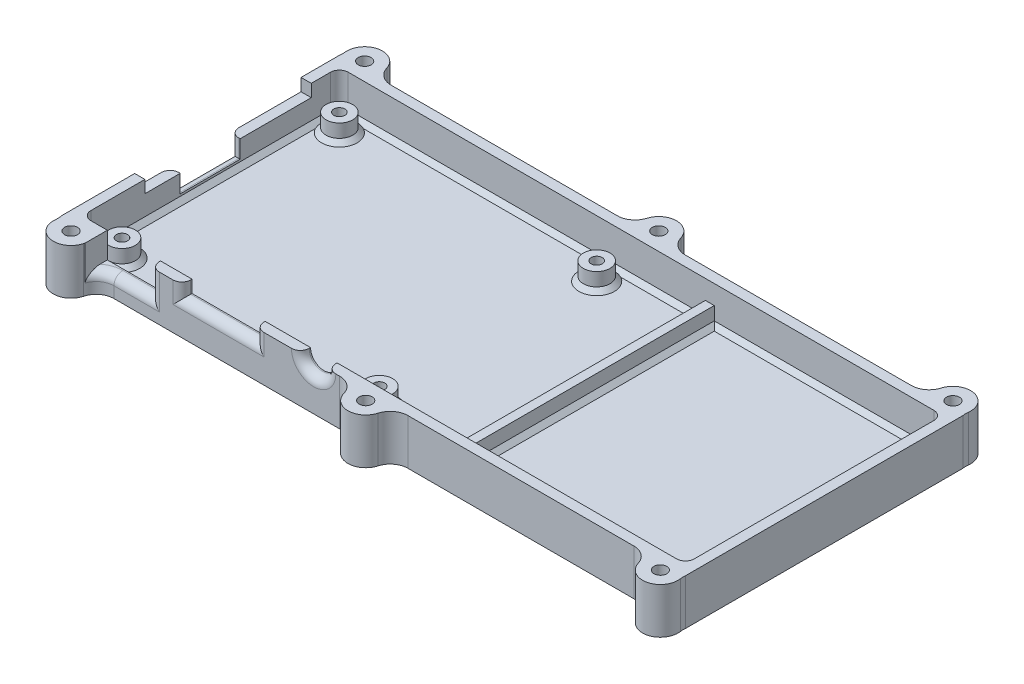
from build123d import *

# Parameters (mm, degrees)
SKETCH3_W                      = 140.6
SKETCH3_H                      = 62.6
SKETCH3_W_2                    = 136
SKETCH3_H_2                    = 58
BOSS_EXTRUDE1_DEPTH            = 10.3
SKETCH5_W                      = 136
SKETCH5_H                      = 58
BOSS_EXTRUDE2_DEPTH            = 2
SKETCH6_R                      = 3
BOSS_EXTRUDE3_DEPTH            = 4
F_2_5_2_5_DIAMETER_HOLE1_D     = 2.5
F_2_5_2_5_DIAMETER_HOLE1_DEPTH = 8
F_2_5_2_5_DIAMETER_HOLE1_TIP   = 0.751075774
SKETCH10_W                     = 2
SKETCH10_H                     = 58
BOSS_EXTRUDE4_DEPTH            = 4
CUT_EXTRUDE1_REACH             = 100.128
SKETCH11_R                     = 3
SKETCH11_W                     = 12
SKETCH11_H                     = 5.8
SKETCH11_W_2                   = 16.5
SKETCH11_H_2                   = 2.8
CUT_EXTRUDE2_REACH             = 147.115
SKETCH12_W                     = 13.5
SKETCH12_H                     = 6.8
SKETCH12_W_2                   = 37.5
SKETCH12_H_2                   = 2.8
SKETCH13_R                     = 4
BOSS_EXTRUDE5_DEPTH            = 10.3
FILLET2_R                      = 4
FILLET3_R                      = 4
FILLET4_R                      = 4
F_2_9_2_9_DIAMETER_HOLE1_D     = 2.9
FILLET6_R                      = 2
FILLET7_R                      = 2
FILLET8_R                      = 2
CHAMFER1_SIZE                  = 1
CHAMFER2_SIZE                  = 1
FILLET9_R                      = 2


with BuildPart() as part:
    # Sketch3 → Boss-Extrude1 (new body)
    with BuildSketch(Plane(origin=(0, 0, 0), x_dir=(1, 0, 0), z_dir=(0, 1, 0))):
        with Locations((-4.561766162, 3.105993834)):
            Rectangle(SKETCH3_W, SKETCH3_H)
        with Locations((-4.561766162, 3.105993834)):
            Rectangle(SKETCH3_W_2, SKETCH3_H_2, mode=Mode.SUBTRACT)
    extrude(amount=BOSS_EXTRUDE1_DEPTH)

    # Sketch5 → Boss-Extrude2 (add)
    with BuildSketch(Plane(origin=(0, 0, 0), x_dir=(1, 0, 0), z_dir=(0, 1, 0))):
        with Locations((-4.561766162, 3.105993834)):
            Rectangle(SKETCH5_W, SKETCH5_H)
    extrude(amount=BOSS_EXTRUDE2_DEPTH)

    # Sketch6 → Boss-Extrude3 (add)
    with BuildSketch(Plane(origin=(0, 2, 0), x_dir=(1, 0, 0), z_dir=(0, 1, 0))):
        with Locations(Location((-68.061766162, 27.605993834, 0), (0, 0, 270))):
            Circle(SKETCH6_R)
        with Locations(Location((-68.061766162, -21.394006166, 0), (0, 0, 270))):
            Circle(SKETCH6_R)
        with Locations(Location((-10.061766162, -21.394006166, 0), (0, 0, 270))):
            Circle(SKETCH6_R)
        with Locations(Location((-10.061766162, 27.605993834, 0), (0, 0, 270))):
            Circle(SKETCH6_R)
    extrude(amount=BOSS_EXTRUDE3_DEPTH)

    # Ø2.5 (2.5) Diameter Hole1
    with Locations(Plane(origin=(0, 6, 0), x_dir=(1, 0, 0), z_dir=(0, 1, 0))):
        with Locations((-68.061766162, 27.605993834), (-10.061766162, 27.605993834), (-10.061766162, -21.394006166), (-68.061766162, -21.394006166)):
            Hole(F_2_5_2_5_DIAMETER_HOLE1_D / 2, depth=F_2_5_2_5_DIAMETER_HOLE1_DEPTH)
            with Locations((0, 0, -(F_2_5_2_5_DIAMETER_HOLE1_DEPTH + F_2_5_2_5_DIAMETER_HOLE1_TIP / 2))):  # 118° drill point
                Cone(0, F_2_5_2_5_DIAMETER_HOLE1_D / 2, F_2_5_2_5_DIAMETER_HOLE1_TIP, mode=Mode.SUBTRACT)

    # Sketch10 → Boss-Extrude4 (add)
    with BuildSketch(Plane(origin=(0, 2, 0), x_dir=(1, 0, 0), z_dir=(0, 1, 0))):
        with Locations((10.938233838, 3.105993834)):
            Rectangle(SKETCH10_W, SKETCH10_H)
    extrude(amount=BOSS_EXTRUDE4_DEPTH)

    # Sketch11 → Cut-Extrude1 (cut, up to next)
    with BuildSketch(Plane.XY.offset(28.194006166), mode=Mode.PRIVATE) as cut_extrude1_sk1:
        with Locations((-18.061766162, 10.3)):
            Circle(SKETCH11_R)
    cut_extrude1_tool1 = extrude(cut_extrude1_sk1.sketch, amount=-CUT_EXTRUDE1_REACH, mode=Mode.PRIVATE) & part.part
    # Sketch11 → Cut-Extrude1 (cut, up to next)
    with BuildSketch(Plane.XY.offset(28.194006166), mode=Mode.PRIVATE) as cut_extrude1_sk2:
        with Locations((-60.861766162, 7.4)):
            Rectangle(SKETCH11_W, SKETCH11_H)
    cut_extrude1_tool2 = extrude(cut_extrude1_sk2.sketch, amount=-CUT_EXTRUDE1_REACH, mode=Mode.PRIVATE) & part.part
    # Sketch11 → Cut-Extrude1 (cut, up to next)
    with BuildSketch(Plane.XY.offset(28.194006166), mode=Mode.PRIVATE) as cut_extrude1_sk3:
        with Locations((-39.527982648, 8.9)):
            Rectangle(SKETCH11_W_2, SKETCH11_H_2)
    cut_extrude1_tool3 = extrude(cut_extrude1_sk3.sketch, amount=-CUT_EXTRUDE1_REACH, mode=Mode.PRIVATE) & part.part
    add(cut_extrude1_tool1.solids().sort_by_distance((-18.061766, 10.3, 28.194006))[0], mode=Mode.SUBTRACT)
    add(cut_extrude1_tool2.solids().sort_by_distance((-60.861766, 7.4, 28.194006))[0], mode=Mode.SUBTRACT)
    add(cut_extrude1_tool3.solids().sort_by_distance((-39.527983, 8.9, 28.194006))[0], mode=Mode.SUBTRACT)

    # Sketch12 → Cut-Extrude2 (cut, up to next)
    with BuildSketch(Plane.ZY.offset(74.861766162), mode=Mode.PRIVATE) as cut_extrude2_sk1:
        with Locations((-2.982922372, 6.9)):
            Rectangle(SKETCH12_W, SKETCH12_H)
    cut_extrude2_tool1 = extrude(cut_extrude2_sk1.sketch, amount=-CUT_EXTRUDE2_REACH, mode=Mode.PRIVATE) & part.part
    # Sketch12 → Cut-Extrude2 (cut, up to next)
    with BuildSketch(Plane.ZY.offset(74.861766162), mode=Mode.PRIVATE) as cut_extrude2_sk2:
        with Locations((-7.016720831, 8.9)):
            Rectangle(SKETCH12_W_2, SKETCH12_H_2)
    cut_extrude2_tool2 = extrude(cut_extrude2_sk2.sketch, amount=-CUT_EXTRUDE2_REACH, mode=Mode.PRIVATE) & part.part
    add(cut_extrude2_tool1.solids().sort_by_distance((-74.861766, 6.9, -2.982922))[0], mode=Mode.SUBTRACT)
    add(cut_extrude2_tool2.solids().sort_by_distance((-74.861766, 8.9, -7.016721))[0], mode=Mode.SUBTRACT)

    # Sketch13 → Boss-Extrude5 (add)
    with BuildSketch(Plane(origin=(0, 0, 0), x_dir=(1, 0, 0), z_dir=(0, 1, 0))):
        with Locations((-70.861766162, 36.105993834)):
            Circle(SKETCH13_R)
        with Locations((-4.561766162, 36.105993834)):
            Circle(SKETCH13_R)
        with Locations((61.738233838, 36.105993834)):
            Circle(SKETCH13_R)
        with Locations((61.796011733, -29.900958235)):
            Circle(SKETCH13_R)
        with Locations((-4.503886668, -30.017026964)):
            Circle(SKETCH13_R)
        with Locations((-70.80378507, -30.133095693)):
            Circle(SKETCH13_R)
    extrude(amount=BOSS_EXTRUDE5_DEPTH)

    # Fillet2
    # the kernel refuses this fillet: 4 mm, written as the material it adds along each edge
    with BuildSketch(Plane(origin=(-74.48253956, 10.3, -34.405993834), x_dir=(-1, 0, 0), z_dir=(0, -1, 0))) as fillet2_piece_1:
        with BuildLine():
            CenterArc((4.316902517, 0.703355094), FILLET2_R, 172.843462622, 17.284010607)
            Line((0.348064559, 1.201677547), (0.2686878, 1.211643996))
            ThreePointArc((0.2686878, 1.211643996), (0.144462277, 0.609403692), (-0.072415468, 0.034))
            Line((-0.072415468, 0.034), (0, -0.08))
            ThreePointArc((0, -0.08), (0.189613301, -0.08), (0.300473084, -0.014067102))
            Line((0.300473084, -0.014067102), (0.379226602, 0))
        make_face()
    extrude(amount=10.3)

    # Fillet3
    fillet3_edges = [part.edges().sort_by_distance(p)[0] for p in [
        (58.178510574, 5.15, 28.194006166),
        (-67.305223679, 5.15, 28.194006166),
        (-0.943466023, 5.15, 28.194006166),
        (-8.064307313, 5.15, 28.194006166),
        (58.11746044, 5.15, -34.405993834),
        (-8.18253956, 5.15, -34.405993834),
        (-0.940992764, 5.15, -34.405993834),
        (-67.240992764, 5.15, -34.405993834),
    ]]
    fillet(fillet3_edges, radius=FILLET3_R)

    # Fillet4
    # the kernel refuses this fillet: 4 mm, written as the material it adds along each edge
    with BuildSketch(Plane(origin=(-74.30234646, 10.3, 28.194006166), x_dir=(-0.3090485748086473, 0, 0.9510462546105442), z_dir=(0, -1, 0))) as fillet4_piece_1:
        with BuildLine():
            CenterArc((2.288815263, 3.926566562), FILLET4_R, 238.063311662, 20.941030322)
            Line((0.172887862, 0.532034012), (0, 0))
            ThreePointArc((0, 0), (0.762938421, 0.073433438), (1.525876842, 0))
        make_face()
    extrude(amount=10.3)
    with BuildSketch(Plane(origin=(65.413512892, 10.3, 28.194006166), x_dir=(0.29133036394129125, 0, 0.9566225060314203), z_dir=(0, -1, 0))) as fillet4_piece_2:
        with BuildLine():
            CenterArc((1.73706251, -3.957869992), FILLET4_R, 98.323104154, 15.92039244)
            Line((0.094601071, -0.310635365), (0, 0))
            ThreePointArc((0, 0), (0.579020837, -0.042130008), (1.158041673, 0))
        make_face()
    extrude(amount=10.3)
    with BuildSketch(Plane(origin=(65.359007236, 10.3, -34.405993834), x_dir=(1, 0, 0), z_dir=(0, -1, 0))) as fillet4_piece_3:
        with BuildLine():
            CenterArc((4.316902517, -0.703355094), FILLET4_R, 169.87252677, 17.284010607)
            ThreePointArc((0.348064559, -1.201677547), (0.221303822, -0.587146624), (0, 0))
            Line((0, 0), (0.379226602, 0))
        make_face()
    extrude(amount=10.3)

    # Ø2.9 (2.9) Diameter Hole1 (through all)
    with Locations(Plane(origin=(0, 10.3, 0), x_dir=(1, 0, 0), z_dir=(0, 1, 0))):
        with Locations((-70.861766162, 36.105993834), (-4.561766162, 36.105993834), (61.738233838, 36.105993834), (61.796011733, -29.900958235), (-4.503886668, -30.017026964), (-70.80378507, -30.133095693)):
            Hole(F_2_9_2_9_DIAMETER_HOLE1_D / 2)

    # Fillet6
    fillet6_edges = [part.edges().sort_by_distance(p)[0] for p in [
        (63.438233838, 6.15, -32.105993834),
    ]]
    fillet(fillet6_edges, radius=FILLET6_R)

    # Fillet7
    fillet7_edges = [part.edges().sort_by_distance(p)[0] for p in [
        (63.438233838, 6.15, 25.894006166),
    ]]
    fillet(fillet7_edges, radius=FILLET7_R)

    # Fillet8
    fillet8_edges = [part.edges().sort_by_distance(p)[0] for p in [
        (-72.561766162, 6.15, -32.105993834),
        (-72.561766162, 6.15, 25.894006166),
    ]]
    fillet(fillet8_edges, radius=FILLET8_R)

    # Chamfer1
    chamfer1_edges = [part.edges().sort_by_distance(p)[0] for p in [
        (-68.061766162, 2, -30.605993834),
        (-68.061766162, 2, 18.394006166),
        (-10.061766162, 2, 18.394006166),
        (-10.061766162, 2, -30.605993834),
    ]]
    chamfer(chamfer1_edges, length=CHAMFER1_SIZE)

    # Chamfer2
    # the kernel refuses this chamfer: 1 mm, written as the material it adds along each edge
    with BuildSketch(Plane(origin=(9.36655085, 2, -32.105993834), x_dir=(0, 0.9996219169112968, -0.027495876610589075), z_dir=(1, 0, 0)), Plane(origin=(61.438233838, 2, 25.894006166), x_dir=(0, 0.9996219169112968, 0.027495876610585623), z_dir=(-1, 0, 0))) as chamfer2_piece_1:
        Polygon((CHAMFER2_SIZE * 0.999621916911, CHAMFER2_SIZE * 0.0274958766106), (-CHAMFER2_SIZE * 0.0274958766106, CHAMFER2_SIZE * 0.999621916911), (0, 0), align=None)
    extrude(amount=52.071682988)
    with BuildSketch(Plane(origin=(61.438233838, 2, -30.105993834), x_dir=(1, 0, 0), z_dir=(0, 0, 1))) as chamfer2_piece_2:
        Polygon((2 - CHAMFER2_SIZE, 0), (2, CHAMFER2_SIZE), (2, 0), align=None)
    revolve(axis=Axis((61.438233838, 2, -30.105993834), (0, 1, 0)), revolution_arc=90)
    with BuildSketch(Plane(origin=(63.438233838, 2, -30.105993834), x_dir=(-0.9996219169112968, -0.02749587661058639, 0), z_dir=(0, 0, 1)), Plane(origin=(-72.561766162, 2, 23.894006166), x_dir=(0.9996219169112968, -0.027495876610586605, 0), z_dir=(0, 0, -1))) as chamfer2_piece_3:
        Polygon((CHAMFER2_SIZE * 0.999621916911, -CHAMFER2_SIZE * 0.0274958766106), (-CHAMFER2_SIZE * 0.0274958766106, -CHAMFER2_SIZE * 0.999621916911), (0, 0), align=None)
    extrude(amount=54)
    with BuildSketch(Plane(origin=(61.438233838, 2, 23.894006166), x_dir=(1, 0, 0), z_dir=(0, 0, -1))) as chamfer2_piece_4:
        Polygon((2 - CHAMFER2_SIZE, 0), (2, -CHAMFER2_SIZE), (2, 0), align=None)
    revolve(axis=Axis((61.438233838, 2, 23.894006166), (0, -1, 0)), revolution_arc=90)
    with BuildSketch(Plane(origin=(12.509916826, 2, 25.894006166), x_dir=(0, -0.027495876610586296, -0.9996219169112968), z_dir=(-1, 0, 0)), Plane(origin=(-70.561766162, 2, -32.105993834), x_dir=(0, -0.027495876610586296, 0.9996219169112968), z_dir=(1, 0, 0))) as chamfer2_piece_5:
        Polygon((CHAMFER2_SIZE * 0.999621916911, -CHAMFER2_SIZE * 0.0274958766106), (-CHAMFER2_SIZE * 0.0274958766106, -CHAMFER2_SIZE * 0.999621916911), (0, 0), align=None)
    extrude(amount=83.071682988)
    with BuildSketch(Plane(origin=(-70.561766162, 2, -30.105993834), x_dir=(0, 0, -1), z_dir=(1, 0, 0))) as chamfer2_piece_6:
        Polygon((2 - CHAMFER2_SIZE, 0), (2, CHAMFER2_SIZE), (2, 0), align=None)
    revolve(axis=Axis((-70.561766162, 2, -30.105993834), (0, 1, 0)), revolution_arc=90)
    with BuildSketch(Plane(origin=(-70.561766162, 2, 23.894006166), x_dir=(0, 0, 1), z_dir=(1, 0, 0))) as chamfer2_piece_7:
        Polygon((2 - CHAMFER2_SIZE, 0), (2, -CHAMFER2_SIZE), (2, 0), align=None)
    revolve(axis=Axis((-70.561766162, 2, 23.894006166), (0, -1, 0)), revolution_arc=90)
    with BuildSketch(Plane(origin=(9.938233838, 2, 28.465689154), x_dir=(-0.9996219169112968, -0.027495876610586296, 0), z_dir=(0, 0, -1))) as chamfer2_piece_8_section:
        Polygon((CHAMFER2_SIZE * 0.999621916911, CHAMFER2_SIZE * 0.0274958766106), (-CHAMFER2_SIZE * 0.0274958766106, CHAMFER2_SIZE * 0.999621916911), (0, 0), align=None)
    chamfer2_piece_8 = extrude(amount=63.143365976, mode=Mode.PRIVATE)
    chamfer2_piece_8 = split(chamfer2_piece_8, bisect_by=Plane(origin=(9.604900504, 2.333333333, 28.194006166), z_dir=(0, 0, -1)), keep=Keep.TOP, mode=Mode.PRIVATE)
    chamfer2_piece_8 = split(chamfer2_piece_8, bisect_by=Plane(origin=(9.604900504, 2.333333333, -34.405993834), z_dir=(0, 0, 1)), keep=Keep.TOP, mode=Mode.PRIVATE)
    add(chamfer2_piece_8)
    with BuildSketch(Plane(origin=(11.938233838, 2, -34.677676822), x_dir=(-0.027495876610585623, 0.9996219169112968, 0), z_dir=(0, 0, 1))) as chamfer2_piece_9_section:
        Polygon((CHAMFER2_SIZE * 0.999621916911, -CHAMFER2_SIZE * 0.0274958766106), (-CHAMFER2_SIZE * 0.0274958766106, -CHAMFER2_SIZE * 0.999621916911), (0, 0), align=None)
    chamfer2_piece_9 = extrude(amount=63.143365976, mode=Mode.PRIVATE)
    chamfer2_piece_9 = split(chamfer2_piece_9, bisect_by=Plane(origin=(12.271567171, 2.333333333, 28.194006166), z_dir=(0, 0, -1)), keep=Keep.TOP, mode=Mode.PRIVATE)
    chamfer2_piece_9 = split(chamfer2_piece_9, bisect_by=Plane(origin=(12.271567171, 2.333333333, -34.405993834), z_dir=(0, 0, 1)), keep=Keep.TOP, mode=Mode.PRIVATE)
    add(chamfer2_piece_9)

    # Fillet9
    fillet9_edges = [part.edges().sort_by_distance(p)[0] for p in [
        (-54.861766162, 7.4, 28.194006166),
        (-47.777982648, 8.9, 28.194006166),
        (-39.527982648, 7.5, 28.194006166),
        (-31.277982648, 8.9, 28.194006166),
        (-18.061766162, 7.3, 28.194006166),
        (-74.861766162, 5.5, -9.732922372),
        (-74.861766162, 3.5, -2.982922372),
        (-74.861766162, 5.5, 3.767077628),
        (-58.967783765, 4.5, 28.194006166),
        (-65.404021091, 4.5, 28.942840829),
    ]]
    fillet(fillet9_edges, radius=FILLET9_R)


solid = part.part
